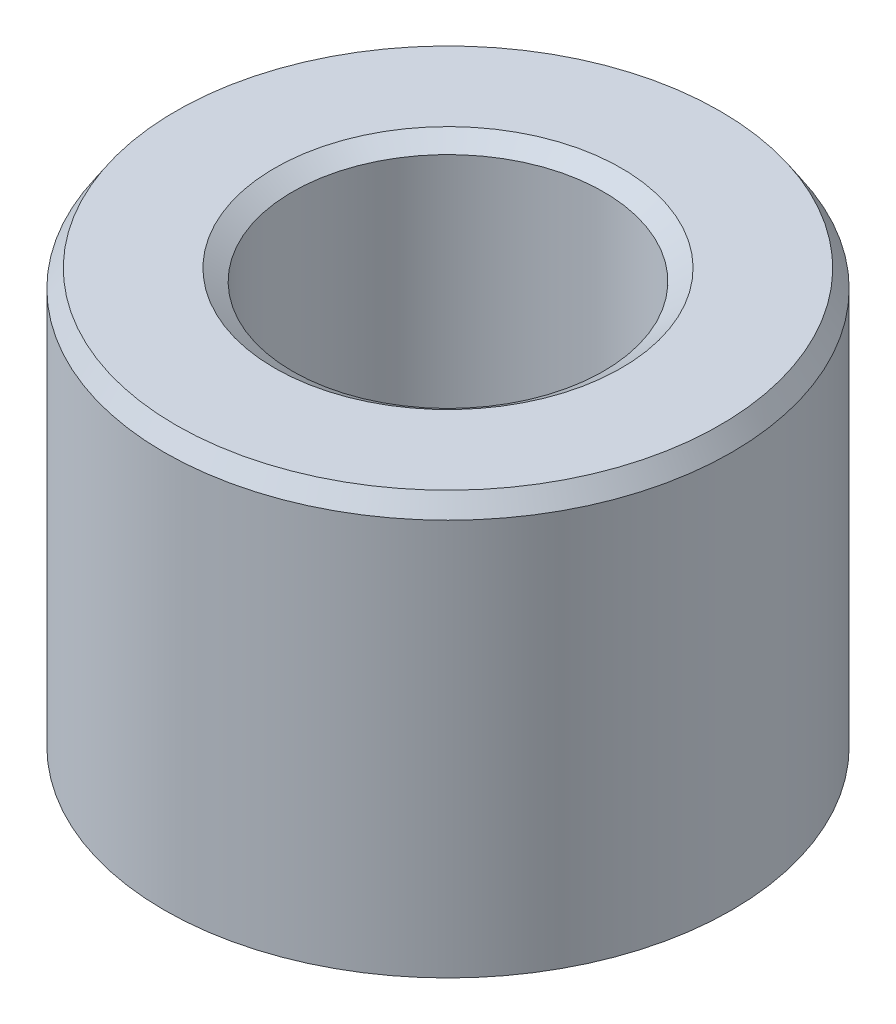
from build123d import *
from OCP.BRepFilletAPI import BRepFilletAPI_MakeChamfer

# Parameters (mm, degrees)
SKETCH1_R           = 42.5
BOSS_EXTRUDE1_DEPTH = 63.799400478
SKETCH2_R           = 23.296092198
CUT_EXTRUDE1_DEPTH  = 88.651945223
CHAMFER1_SIZE       = 2.667739441
CHAMFER1_SIZE2      = 1.742773336


with BuildPart() as part:
    # Sketch1 → Boss-Extrude1 (new body)
    with BuildSketch(Plane(origin=(0, 0, 0), x_dir=(1, 0, 0), z_dir=(0, 1, 0))):
        Circle(SKETCH1_R)
    extrude(amount=BOSS_EXTRUDE1_DEPTH)

    # Sketch2 → Cut-Extrude1 (cut, through all)
    with BuildSketch(Plane(origin=(0, 0, 0), x_dir=(1, 0, 0), z_dir=(0, 1, 0))):
        Circle(SKETCH2_R)
    extrude(amount=CUT_EXTRUDE1_DEPTH, mode=Mode.SUBTRACT)

    # Chamfer1: one chamfer whose edges measure the first distance from different faces: ONE call of the kernel's chamfer builder (chamfer() names one face for all edges)
    chamfer1_edges_1 = [part.edges().sort_by_distance(p)[0] for p in [
        (-23.296092198, 63.799400478, 0),
    ]]
    chamfer1_side_1 = [part.faces().sort_by_distance(p)[0] for p in [
        (-41.297918472, 63.799400478, 0),
    ]]
    chamfer1_edges_2 = [part.edges().sort_by_distance(p)[0] for p in [
        (-23.296092198, 0, 0),
    ]]
    chamfer1_side_2 = [part.faces().sort_by_distance(p)[0] for p in [
        (-23.296092198, 31.899700239, 0),
    ]]
    chamfer1_edges_3 = [part.edges().sort_by_distance(p)[0] for p in [
        (-42.5, 0, 0),
    ]]
    chamfer1_side_3 = [part.faces().sort_by_distance(p)[0] for p in [
        (-41.297918472, 0, 0),
    ]]
    chamfer1_edges_4 = [part.edges().sort_by_distance(p)[0] for p in [
        (-42.5, 63.799400478, 0),
    ]]
    chamfer1_side_4 = [part.faces().sort_by_distance(p)[0] for p in [
        (-42.5, 31.899700239, 0),
    ]]
    chamfer1 = BRepFilletAPI_MakeChamfer(part.part.solid().wrapped)
    for e in chamfer1_edges_1:
        chamfer1.Add(CHAMFER1_SIZE, CHAMFER1_SIZE2, e.wrapped, chamfer1_side_1[0].wrapped)  # the first distance lies on this face
    for e in chamfer1_edges_2:
        chamfer1.Add(CHAMFER1_SIZE, CHAMFER1_SIZE2, e.wrapped, chamfer1_side_2[0].wrapped)  # the first distance lies on this face
    for e in chamfer1_edges_3:
        chamfer1.Add(CHAMFER1_SIZE, CHAMFER1_SIZE2, e.wrapped, chamfer1_side_3[0].wrapped)  # the first distance lies on this face
    for e in chamfer1_edges_4:
        chamfer1.Add(CHAMFER1_SIZE, CHAMFER1_SIZE2, e.wrapped, chamfer1_side_4[0].wrapped)  # the first distance lies on this face
    add(Compound.cast(chamfer1.Shape()), mode=Mode.REPLACE)


solid = part.part
